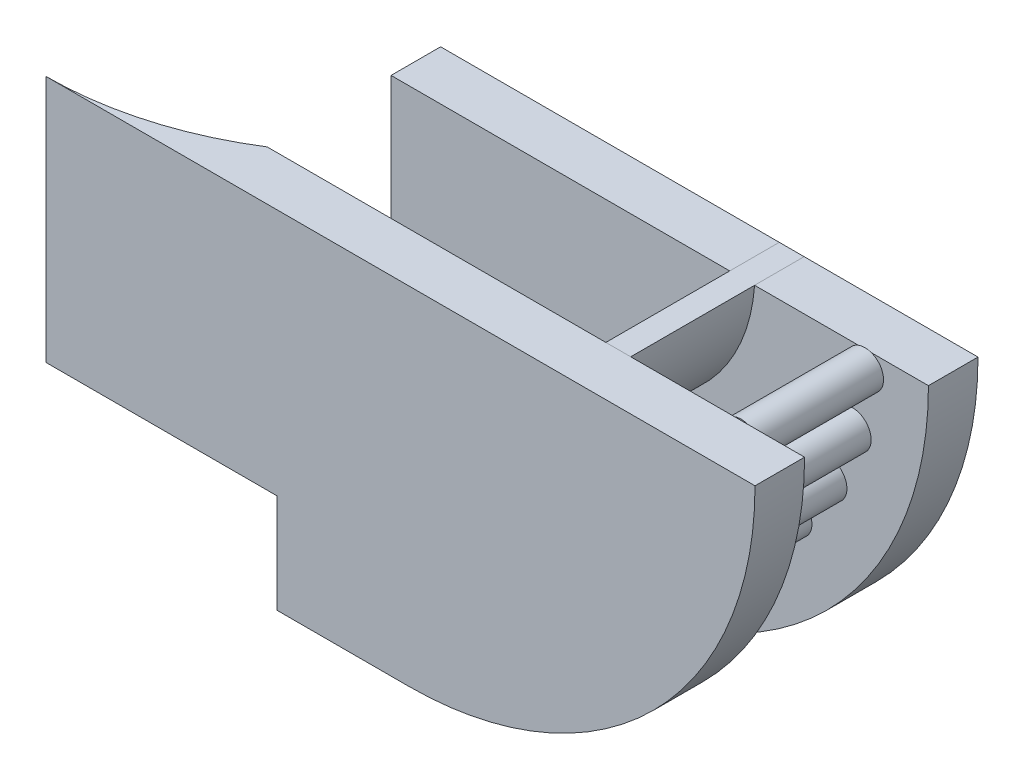
from build123d import *

# Parameters (mm, degrees)
EXTRUDE_1_DEPTH = 10
EXTRUDE_3_DEPTH = 20
EXTRUDE_START   = 20
EXTRUDE_4_DEPTH = 50
EXTRUDE_START_2 = 25
EXTRUDE_5_DEPTH = 10
SKETCH_3_R      = 3.75
EXTRUDE_6_DEPTH = 25
EXTRUDE_9_DEPTH = 35


# Read off the part's stored shape, not the designer's step: 凸台-拉伸3, 凸台-拉伸4
with BuildPart() as part:
    # 草图1 → 凸台-拉伸1 (new body)
    with BuildSketch(Plane.XY):
        with BuildLine():
            Line((0, 0), (15, 0))
            ThreePointArc((15, 0), (64.497474683, 20.502525317), (85, 70))
            Line((85, 70), (15, 70))
            Line((15, 70), (0, 70))
            Line((0, 70), (0, 20))
            Line((0, 20), (0, 0))
        make_face()
    extrude(amount=EXTRUDE_1_DEPTH)

    # 凸台-拉伸3 outline → 凸台-拉伸3 (add)
    with BuildSketch(Plane(origin=(0, 0, 0), x_dir=(1, 0, 0), z_dir=(0, 1, 0))):
        with BuildLine():
            ThreePointArc((0, 0), (-5.490763746, -5.272884533), (-11.457854928, -10))
            Line((-11.457854928, -10), (0, -10))
            Line((0, -10), (0, 0))
        make_face()
    extrude(amount=EXTRUDE_3_DEPTH)

    # 凸台-拉伸4 outline → 凸台-拉伸4 (add)
    with BuildSketch(Plane(origin=(0, 0, 0), x_dir=(1, 0, 0), z_dir=(0, 1, 0)).offset(EXTRUDE_START)):
        with BuildLine():
            ThreePointArc((-23.453734042, 0), (-40.066993816, -7.449979984), (-58.094750193, -10))
            Line((-58.094750193, -10), (0, -10))
            Line((0, -10), (0, 0))
            Line((0, 0), (-23.453734042, 0))
        make_face()
    extrude(amount=EXTRUDE_4_DEPTH)



with BuildPart() as body_2:
    # 草图6 → 凸台-拉伸5 (new body)
    with BuildSketch(Plane(origin=(0, 0, 0), x_dir=(-1, 0, 0), z_dir=(0, 0, -1)).offset(EXTRUDE_START_2)):
        with BuildLine():
            Line((-15, 0), (0, 0))
            Line((0, 0), (0, 20))
            Line((0, 20), (23.453734042, 20))
            Line((23.453734042, 20), (23.453734042, 70))
            Line((23.453734042, 70), (-85, 70))
            ThreePointArc((-85, 70), (-64.497474683, 20.502525317), (-15, 0))
        make_face()
    extrude(amount=EXTRUDE_5_DEPTH)


with BuildPart() as part_1:
    add(part.part)

    add(body_2.part)  # 凸台-拉伸6 merges body 2
    # 草图3 → 凸台-拉伸6 (add)
    with BuildSketch(Plane(origin=(0, 0, 0), x_dir=(-1, 0, 0), z_dir=(0, 0, -1))):
        with Locations(Location((-15, 15, 0), (0, 0, 180))):
            Circle(SKETCH_3_R)
        with Locations(Location((-26.954922222, 16.256512958, 0), (0, 0, 180))):
            Circle(SKETCH_3_R)
        with Locations(Location((-38.387356977, 19.971136186, 0), (0, 0, 180))):
            Circle(SKETCH_3_R)
        with Locations(Location((-48.797652007, 25.981522823, 0), (0, 0, 180))):
            Circle(SKETCH_3_R)
        with Locations(Location((-57.730827465, 34.024990134, 0), (0, 0, 180))):
            Circle(SKETCH_3_R)
        with Locations(Location((-64.796460718, 43.75, 0), (0, 0, 180))):
            Circle(SKETCH_3_R)
        with Locations(Location((-69.685749687, 54.731522823, 0), (0, 0, 180))):
            Circle(SKETCH_3_R)
        with Locations(Location((-72.185008984, 66.489613362, 0), (0, 0, 110.592904033))):
            Circle(SKETCH_3_R)
        with Locations(Location((-3.957469551, 15, 0), (0, 0, 180))):
            Circle(SKETCH_3_R)
    extrude(amount=EXTRUDE_6_DEPTH)


with BuildPart() as body_2_2:
    # 草图8 → 凸台-拉伸9 (new body)
    with BuildSketch(Plane(origin=(0, 0, -35), x_dir=(-1, 0, 0), z_dir=(0, 0, -1))):
        with BuildLine():
            Line((-15, 37.5), (0, 37.5))
            Line((0, 37.5), (0, 42.5))
            Line((0, 42.5), (-15, 42.5))
            ThreePointArc((-15, 42.5), (-35.310096012, 50.420597834), (-44.895651858, 70))
            Line((-44.895651858, 70), (-44.919254128, 70))
            Line((-44.919254128, 70), (-49.910600109, 70))
            ThreePointArc((-49.910600109, 70), (-38.848480035, 46.882623085), (-15, 37.5))
        make_face()
    extrude(amount=-EXTRUDE_9_DEPTH)


solid = Compound([part_1.part, body_2_2.part])
